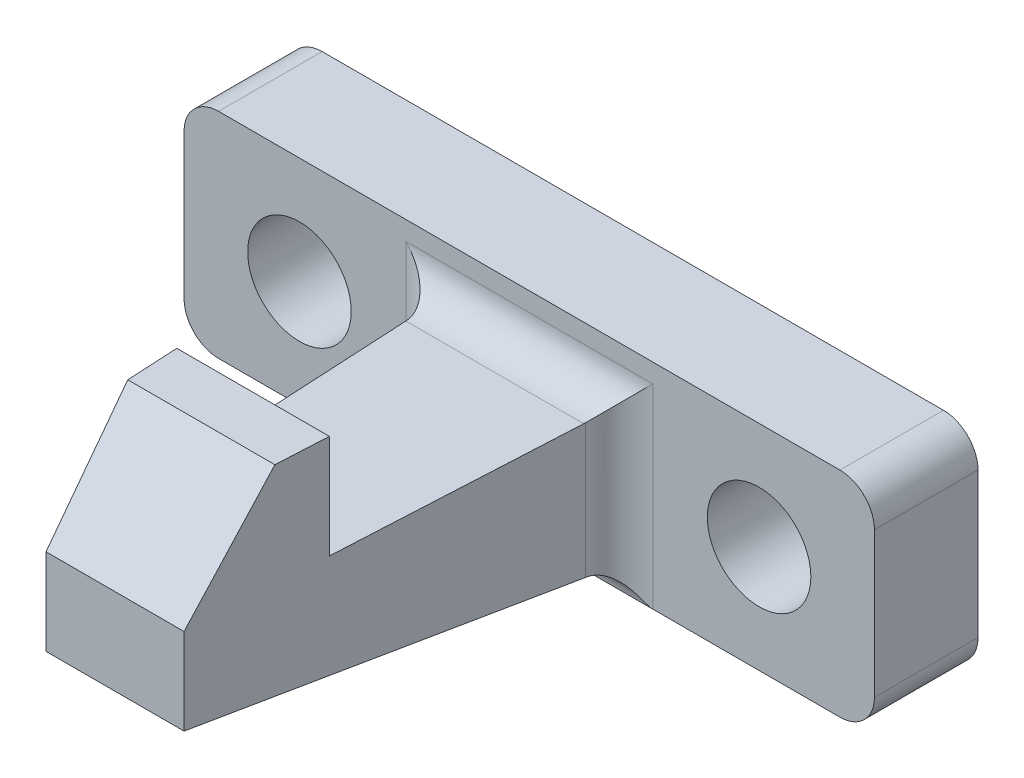
from build123d import *

# Parameters (mm, degrees)
SKETCH1_W           = 20
SKETCH1_H           = 6.2
BOSS_EXTRUDE1_DEPTH = 3
SNAP_START          = -0.95
SNAP_HOOK1_DEPTH    = 2.5
SNAP_START_2        = -1.274844
SNAP_HOOK1_2_DEPTH  = 2.48
SNAP_START_3        = -2.209631117
SNAP_HOOK1_3_DEPTH  = 4.419262234
SNAP_START_4        = -2.628893351
SNAP_HOOK1_4_DEPTH  = 5.257786702
SNAP_START_5        = -3
SNAP_HOOK1_5_DEPTH  = 9
FILLET1_R           = 1
CUT_EXTRUDE1_REACH  = 18.27
SKETCH3_R           = 1.5
FILLET2_R           = 1


with BuildPart() as part:
    # Sketch1 → Boss-Extrude1 (new body)
    with BuildSketch(Plane.XY):
        Rectangle(SKETCH1_W, SKETCH1_H)
    extrude(amount=BOSS_EXTRUDE1_DEPTH)

    # Snap Hook1: read off the stored shape, not the designer's step
    # Snap Hook1 outline → Snap Hook1 (add)
    with BuildSketch(Plane(origin=(0, 0, 0), x_dir=(1, 0, 0), z_dir=(0, 1, 0)).offset(SNAP_START)):
        Polygon((2.628893351, -3), (-2.628893351, -3), (-2, -15), (2, -15), align=None)
    extrude(amount=SNAP_HOOK1_DEPTH)

    # Snap Hook1 2 outline → Snap Hook1 2 (add)
    with BuildSketch(Plane(origin=(0, 0, 0), x_dir=(1, 0, 0), z_dir=(0, 1, 0)).offset(SNAP_START_2)):
        Polygon((2.628893351, -3), (-2.628893351, -3), (-2.209631117, -11), (2.209631117, -11), align=None)
    extrude(amount=SNAP_HOOK1_2_DEPTH)

    # Snap Hook1 3 outline → Snap Hook1 3 (add)
    with BuildSketch(Plane.YZ.offset(SNAP_START_3)):
        Polygon((-0.95, 11), (-0.95, 15), (-2.45, 3), (-1.274844, 3), (-1.274844, 11), align=None)
        Polygon((1.55, 15), (1.55, 11), (4.55, 11), (4.55, 12.5), align=None)
    extrude(amount=SNAP_HOOK1_3_DEPTH)

    # Snap Hook1 4 outline → Snap Hook1 4 (add)
    with BuildSketch(Plane.YZ.offset(SNAP_START_4)):
        Polygon((-0.95, 11), (-0.95, 15), (-2.45, 3), (-1.274844, 3), (-1.274844, 11), align=None)
    extrude(amount=SNAP_HOOK1_4_DEPTH)

    # Snap Hook1 5 outline → Snap Hook1 5 (cut)
    with BuildSketch(Plane(origin=(0, 0, 0), x_dir=(1, 0, 0), z_dir=(0, 1, 0)).offset(SNAP_START_5)):
        Polygon((-2.628893351, -3), (-2.628893351, -16), (-1.947592221, -16), (-2, -15), align=None)
        Polygon((2, -15), (1.947592221, -16), (2.628893351, -16), (2.628893351, -3), align=None)
    extrude(amount=SNAP_HOOK1_5_DEPTH, mode=Mode.SUBTRACT)

    # Fillet1
    # the kernel refuses this fillet: 1 mm, written as the material it adds along each edge
    with BuildSketch(Plane(origin=(5.128893351, 1.55, 3), x_dir=(0, 1, 0), z_dir=(-1, 0, 0))) as fillet1_piece_1_section:
        with BuildLine():
            CenterArc((FILLET1_R, -FILLET1_R), FILLET1_R, 90, 90)
            Line((0, -FILLET1_R), (-FILLET1_R * 0.02, -FILLET1_R))
            Line((-FILLET1_R * 0.02, -FILLET1_R), (-FILLET1_R * 0.02, FILLET1_R * 0.02))
            Line((-FILLET1_R * 0.02, FILLET1_R * 0.02), (FILLET1_R, FILLET1_R * 0.02))
            Line((FILLET1_R, FILLET1_R * 0.02), (FILLET1_R, 0))
        make_face()
    fillet1_piece_1 = extrude(amount=10.257786702, mode=Mode.PRIVATE)
    fillet1_piece_1 = split(fillet1_piece_1, bisect_by=Plane(origin=(-2.607644367, 1.55, 3.405454761), z_dir=(0.9986295347562985, 0, -0.05233595621003828)), keep=Keep.TOP, mode=Mode.PRIVATE)
    fillet1_piece_1 = split(fillet1_piece_1, bisect_by=Plane(origin=(2.635740982, 1.55, 2.869339421), z_dir=(-0.9986295347562985, 0, -0.0523359562100383)), keep=Keep.TOP, mode=Mode.PRIVATE)
    add(fillet1_piece_1)
    with BuildSketch(Plane(origin=(2.628893351, 1.55, 3), x_dir=(1, 0, 0), z_dir=(0, -1, 0))) as fillet1_piece_2_section:
        with BuildLine():
            CenterArc((FILLET1_R * 0.948964566746, FILLET1_R), FILLET1_R, 182.999999998, 87.000000002)
            Line((-FILLET1_R * 0.0496649680101, FILLET1_R * 0.94766404379), (-FILLET1_R * 0.0696375587052, FILLET1_R * 0.946617324666))
            Line((-FILLET1_R * 0.0696375587052, FILLET1_R * 0.946617324666), (-FILLET1_R * 0.0189792913349, -FILLET1_R * 0.02))
            Line((-FILLET1_R * 0.0189792913349, -FILLET1_R * 0.02), (FILLET1_R * 0.948964566746, -FILLET1_R * 0.02))
            Line((FILLET1_R * 0.948964566746, -FILLET1_R * 0.02), (FILLET1_R * 0.948964566746, 0))
        make_face()
    fillet1_piece_2 = extrude(amount=6.372411417, mode=Mode.PRIVATE)
    fillet1_piece_2 = split(fillet1_piece_2, bisect_by=Plane(origin=(2.628893351, -2.388461538, 3.492307692), z_dir=(0, 0.9922778767136677, -0.12403473458920848)), keep=Keep.TOP, mode=Mode.PRIVATE)
    add(fillet1_piece_2)
    with BuildSketch(Plane(origin=(4.76448426, -2.45, 3), x_dir=(0, -1, 0), z_dir=(-1, 0, 0))) as fillet1_piece_3_section:
        with BuildLine():
            CenterArc((0.886322896, 0.97167458), FILLET1_R, 187.125016349, 69.205367851)
            Line((-0.105954981, 0.847639845), (-0.125800538, 0.84515915))
            Line((-0.125800538, 0.84515915), (-0.019845558, -0.002480695))
            Line((-0.019845558, -0.002480695), (0, -0.02))
            ThreePointArc((0, -0.02), (0.325, -0.02), (0.645273542, -0.019433492))
            Line((0.645273542, -0.019433492), (0.65, 0))
        make_face()
    fillet1_piece_3 = extrude(amount=9.52896852, mode=Mode.PRIVATE)
    fillet1_piece_3 = split(fillet1_piece_3, bisect_by=Plane(origin=(2.634742846, -2.45, 2.888384982), z_dir=(-0.9986295347562985, 0, -0.0523359562100383)), keep=Keep.TOP, mode=Mode.PRIVATE)
    fillet1_piece_3 = split(fillet1_piece_3, bisect_by=Plane(origin=(-2.608642503, -2.45, 3.3864092), z_dir=(0.9986295347562985, 0, -0.05233595621003828)), keep=Keep.TOP, mode=Mode.PRIVATE)
    add(fillet1_piece_3)
    with BuildSketch(Plane(origin=(-2.628893351, -4.822411417, 3), x_dir=(-1, 0, 0), z_dir=(0, 1, 0))) as fillet1_piece_4_section:
        with BuildLine():
            CenterArc((FILLET1_R * 0.948964566746, FILLET1_R), FILLET1_R, 182.999999998, 87.000000002)
            Line((-FILLET1_R * 0.0496649680101, FILLET1_R * 0.94766404379), (-FILLET1_R * 0.0696375587052, FILLET1_R * 0.946617324666))
            Line((-FILLET1_R * 0.0696375587052, FILLET1_R * 0.946617324666), (-FILLET1_R * 0.0189792913349, -FILLET1_R * 0.02))
            Line((-FILLET1_R * 0.0189792913349, -FILLET1_R * 0.02), (FILLET1_R * 0.948964566746, -FILLET1_R * 0.02))
            Line((FILLET1_R * 0.948964566746, -FILLET1_R * 0.02), (FILLET1_R * 0.948964566746, 0))
        make_face()
    fillet1_piece_4 = extrude(amount=6.372411417, mode=Mode.PRIVATE)
    fillet1_piece_4 = split(fillet1_piece_4, bisect_by=Plane(origin=(-2.628893351, -2.486498637, 2.708010903), z_dir=(0, 0.9922778767136677, -0.12403473458920848)), keep=Keep.TOP, mode=Mode.PRIVATE)
    add(fillet1_piece_4)
    with BuildSketch(Plane(origin=(2.628893351, 3.922411417, 3), x_dir=(1, 0, 0), z_dir=(0, -1, 0))) as fillet1_piece_5a_section:
        with BuildLine():
            CenterArc((FILLET1_R * 0.948964566746, FILLET1_R), FILLET1_R, 182.999999998, 87.000000002)
            Line((-FILLET1_R * 0.0496649680101, FILLET1_R * 0.94766404379), (-FILLET1_R * 0.0696375587052, FILLET1_R * 0.946617324666))
            Line((-FILLET1_R * 0.0696375587052, FILLET1_R * 0.946617324666), (-FILLET1_R * 0.0189792913349, -FILLET1_R * 0.02))
            Line((-FILLET1_R * 0.0189792913349, -FILLET1_R * 0.02), (FILLET1_R * 0.948964566746, -FILLET1_R * 0.02))
            Line((FILLET1_R * 0.948964566746, -FILLET1_R * 0.02), (FILLET1_R * 0.948964566746, 0))
        make_face()
    fillet1_piece_5a = extrude(amount=8.744822834, mode=Mode.PRIVATE)
    fillet1_piece_5a = split(fillet1_piece_5a, bisect_by=Plane(origin=(2.628893351, 3.1, 3), z_dir=(0, -1, 0)), keep=Keep.TOP, mode=Mode.PRIVATE)
    fillet1_piece_5a = split(fillet1_piece_5a, bisect_by=Plane(origin=(2.628893351, 1.55, 3), z_dir=(0, 1, 0)), keep=Keep.TOP, mode=Mode.PRIVATE)
    with BuildSketch(Plane(origin=(5.128893351, 1.55, 3), x_dir=(0, 1, 0), z_dir=(-1, 0, 0))) as fillet1_piece_5b_section:
        with BuildLine():
            CenterArc((FILLET1_R, -FILLET1_R), FILLET1_R, 90, 90)
            Line((0, -FILLET1_R), (-FILLET1_R * 0.02, -FILLET1_R))
            Line((-FILLET1_R * 0.02, -FILLET1_R), (-FILLET1_R * 0.02, FILLET1_R * 0.02))
            Line((-FILLET1_R * 0.02, FILLET1_R * 0.02), (FILLET1_R, FILLET1_R * 0.02))
            Line((FILLET1_R, FILLET1_R * 0.02), (FILLET1_R, 0))
        make_face()
    fillet1_piece_5b = extrude(amount=10.257786702, mode=Mode.PRIVATE)
    fillet1_piece_5b = split(fillet1_piece_5b, bisect_by=Plane(origin=(2.635740982, 1.55, 2.869339421), z_dir=(0.9986295347562985, 0, 0.0523359562100383)), keep=Keep.TOP, mode=Mode.PRIVATE)
    fillet1_piece_5 = fillet1_piece_5a & fillet1_piece_5b
    add(fillet1_piece_5)
    with BuildSketch(Plane(origin=(5.128893351, 1.55, 3), x_dir=(0, 1, 0), z_dir=(-1, 0, 0))) as fillet1_piece_6a_section:
        with BuildLine():
            CenterArc((FILLET1_R, -FILLET1_R), FILLET1_R, 90, 90)
            Line((0, -FILLET1_R), (-FILLET1_R * 0.02, -FILLET1_R))
            Line((-FILLET1_R * 0.02, -FILLET1_R), (-FILLET1_R * 0.02, FILLET1_R * 0.02))
            Line((-FILLET1_R * 0.02, FILLET1_R * 0.02), (FILLET1_R, FILLET1_R * 0.02))
            Line((FILLET1_R, FILLET1_R * 0.02), (FILLET1_R, 0))
        make_face()
    fillet1_piece_6a = extrude(amount=10.257786702, mode=Mode.PRIVATE)
    fillet1_piece_6a = split(fillet1_piece_6a, bisect_by=Plane(origin=(-2.607644367, 1.55, 3.405454761), z_dir=(-0.9986295347562985, 0, 0.05233595621003828)), keep=Keep.TOP, mode=Mode.PRIVATE)
    with BuildSketch(Plane(origin=(-2.628893351, -4.822411417, 3), x_dir=(-1, 0, 0), z_dir=(0, 1, 0))) as fillet1_piece_6b_section:
        with BuildLine():
            CenterArc((FILLET1_R * 0.948964566746, FILLET1_R), FILLET1_R, 182.999999998, 87.000000002)
            Line((-FILLET1_R * 0.0496649680101, FILLET1_R * 0.94766404379), (-FILLET1_R * 0.0696375587052, FILLET1_R * 0.946617324666))
            Line((-FILLET1_R * 0.0696375587052, FILLET1_R * 0.946617324666), (-FILLET1_R * 0.0189792913349, -FILLET1_R * 0.02))
            Line((-FILLET1_R * 0.0189792913349, -FILLET1_R * 0.02), (FILLET1_R * 0.948964566746, -FILLET1_R * 0.02))
            Line((FILLET1_R * 0.948964566746, -FILLET1_R * 0.02), (FILLET1_R * 0.948964566746, 0))
        make_face()
    fillet1_piece_6b = extrude(amount=8.744822834, mode=Mode.PRIVATE)
    fillet1_piece_6b = split(fillet1_piece_6b, bisect_by=Plane(origin=(-2.628893351, 3.1, 3), z_dir=(0, -1, 0)), keep=Keep.TOP, mode=Mode.PRIVATE)
    fillet1_piece_6b = split(fillet1_piece_6b, bisect_by=Plane(origin=(-2.628893351, 1.55, 3), z_dir=(0, 1, 0)), keep=Keep.TOP, mode=Mode.PRIVATE)
    fillet1_piece_6 = fillet1_piece_6a & fillet1_piece_6b
    add(fillet1_piece_6)
    with BuildSketch(Plane(origin=(2.628893351, 1.55, 3), x_dir=(1, 0, 0), z_dir=(0, -1, 0))) as fillet1_piece_7a_section:
        with BuildLine():
            CenterArc((FILLET1_R * 0.948964566746, FILLET1_R), FILLET1_R, 182.999999998, 87.000000002)
            Line((-FILLET1_R * 0.0496649680101, FILLET1_R * 0.94766404379), (-FILLET1_R * 0.0696375587052, FILLET1_R * 0.946617324666))
            Line((-FILLET1_R * 0.0696375587052, FILLET1_R * 0.946617324666), (-FILLET1_R * 0.0189792913349, -FILLET1_R * 0.02))
            Line((-FILLET1_R * 0.0189792913349, -FILLET1_R * 0.02), (FILLET1_R * 0.948964566746, -FILLET1_R * 0.02))
            Line((FILLET1_R * 0.948964566746, -FILLET1_R * 0.02), (FILLET1_R * 0.948964566746, 0))
        make_face()
    fillet1_piece_7a = extrude(amount=6.372411417, mode=Mode.PRIVATE)
    fillet1_piece_7a = split(fillet1_piece_7a, bisect_by=Plane(origin=(2.628893351, -3.1, 3), z_dir=(0, 1, 0)), keep=Keep.TOP, mode=Mode.PRIVATE)
    fillet1_piece_7a = split(fillet1_piece_7a, bisect_by=Plane(origin=(2.628893351, -2.388461538, 3.492307692), z_dir=(0, -0.9922778767136677, 0.12403473458920848)), keep=Keep.TOP, mode=Mode.PRIVATE)
    with BuildSketch(Plane(origin=(4.76448426, -2.45, 3), x_dir=(0, -1, 0), z_dir=(-1, 0, 0))) as fillet1_piece_7b_section:
        with BuildLine():
            CenterArc((0.886322896, 0.97167458), FILLET1_R, 187.125016349, 69.205367851)
            Line((-0.105954981, 0.847639845), (-0.125800538, 0.84515915))
            Line((-0.125800538, 0.84515915), (-0.019845558, -0.002480695))
            Line((-0.019845558, -0.002480695), (0, -0.02))
            ThreePointArc((0, -0.02), (0.325, -0.02), (0.645273542, -0.019433492))
            Line((0.645273542, -0.019433492), (0.65, 0))
        make_face()
    fillet1_piece_7b = extrude(amount=9.52896852, mode=Mode.PRIVATE)
    fillet1_piece_7b = split(fillet1_piece_7b, bisect_by=Plane(origin=(2.634742846, -2.45, 2.888384982), z_dir=(0.9986295347562985, 0, 0.0523359562100383)), keep=Keep.TOP, mode=Mode.PRIVATE)
    fillet1_piece_7 = fillet1_piece_7a & fillet1_piece_7b
    add(fillet1_piece_7)
    with BuildSketch(Plane(origin=(-2.628893351, -4.822411417, 3), x_dir=(-1, 0, 0), z_dir=(0, 1, 0))) as fillet1_piece_8a_section:
        with BuildLine():
            CenterArc((FILLET1_R * 0.948964566746, FILLET1_R), FILLET1_R, 182.999999998, 87.000000002)
            Line((-FILLET1_R * 0.0496649680101, FILLET1_R * 0.94766404379), (-FILLET1_R * 0.0696375587052, FILLET1_R * 0.946617324666))
            Line((-FILLET1_R * 0.0696375587052, FILLET1_R * 0.946617324666), (-FILLET1_R * 0.0189792913349, -FILLET1_R * 0.02))
            Line((-FILLET1_R * 0.0189792913349, -FILLET1_R * 0.02), (FILLET1_R * 0.948964566746, -FILLET1_R * 0.02))
            Line((FILLET1_R * 0.948964566746, -FILLET1_R * 0.02), (FILLET1_R * 0.948964566746, 0))
        make_face()
    fillet1_piece_8a = extrude(amount=6.372411417, mode=Mode.PRIVATE)
    fillet1_piece_8a = split(fillet1_piece_8a, bisect_by=Plane(origin=(-2.628893351, -3.1, 3), z_dir=(0, 1, 0)), keep=Keep.TOP, mode=Mode.PRIVATE)
    fillet1_piece_8a = split(fillet1_piece_8a, bisect_by=Plane(origin=(-2.628893351, -2.486498637, 2.708010903), z_dir=(0, -0.9922778767136677, 0.12403473458920848)), keep=Keep.TOP, mode=Mode.PRIVATE)
    with BuildSketch(Plane(origin=(4.76448426, -2.45, 3), x_dir=(0, -1, 0), z_dir=(-1, 0, 0))) as fillet1_piece_8b_section:
        with BuildLine():
            CenterArc((0.886322896, 0.97167458), FILLET1_R, 187.125016349, 69.205367851)
            Line((-0.105954981, 0.847639845), (-0.125800538, 0.84515915))
            Line((-0.125800538, 0.84515915), (-0.019845558, -0.002480695))
            Line((-0.019845558, -0.002480695), (0, -0.02))
            ThreePointArc((0, -0.02), (0.325, -0.02), (0.645273542, -0.019433492))
            Line((0.645273542, -0.019433492), (0.65, 0))
        make_face()
    fillet1_piece_8b = extrude(amount=9.52896852, mode=Mode.PRIVATE)
    fillet1_piece_8b = split(fillet1_piece_8b, bisect_by=Plane(origin=(-2.608642503, -2.45, 3.3864092), z_dir=(-0.9986295347562985, 0, 0.05233595621003828)), keep=Keep.TOP, mode=Mode.PRIVATE)
    fillet1_piece_8 = fillet1_piece_8a & fillet1_piece_8b
    add(fillet1_piece_8)

    # Sketch3 → Cut-Extrude1 (cut, up to next)
    with BuildSketch(Plane.XY.offset(3), mode=Mode.PRIVATE) as cut_extrude1_sk1:
        with Locations((-6.65790951, 0)):
            Circle(SKETCH3_R)
    cut_extrude1_tool1 = extrude(cut_extrude1_sk1.sketch, amount=-CUT_EXTRUDE1_REACH, mode=Mode.PRIVATE) & part.part
    cut_extrude1 = cut_extrude1_tool1.solids().sort_by_distance((-6.65791, 0, 3))[0]
    add(cut_extrude1, mode=Mode.SUBTRACT)

    # Mirror1: Cut-Extrude1 across plane
    add(cut_extrude1.mirror(Plane(origin=(0, 0, 0), x_dir=(0, 0, 1), z_dir=(1, 0, 0))), mode=Mode.SUBTRACT)

    # Fillet2
    fillet2_edges = [part.edges().sort_by_distance(p)[0] for p in [
        (10, -3.1, 1.5),
        (-10, -3.1, 1.5),
        (-10, 3.1, 1.5),
        (10, 3.1, 1.5),
    ]]
    fillet(fillet2_edges, radius=FILLET2_R)


solid = part.part
